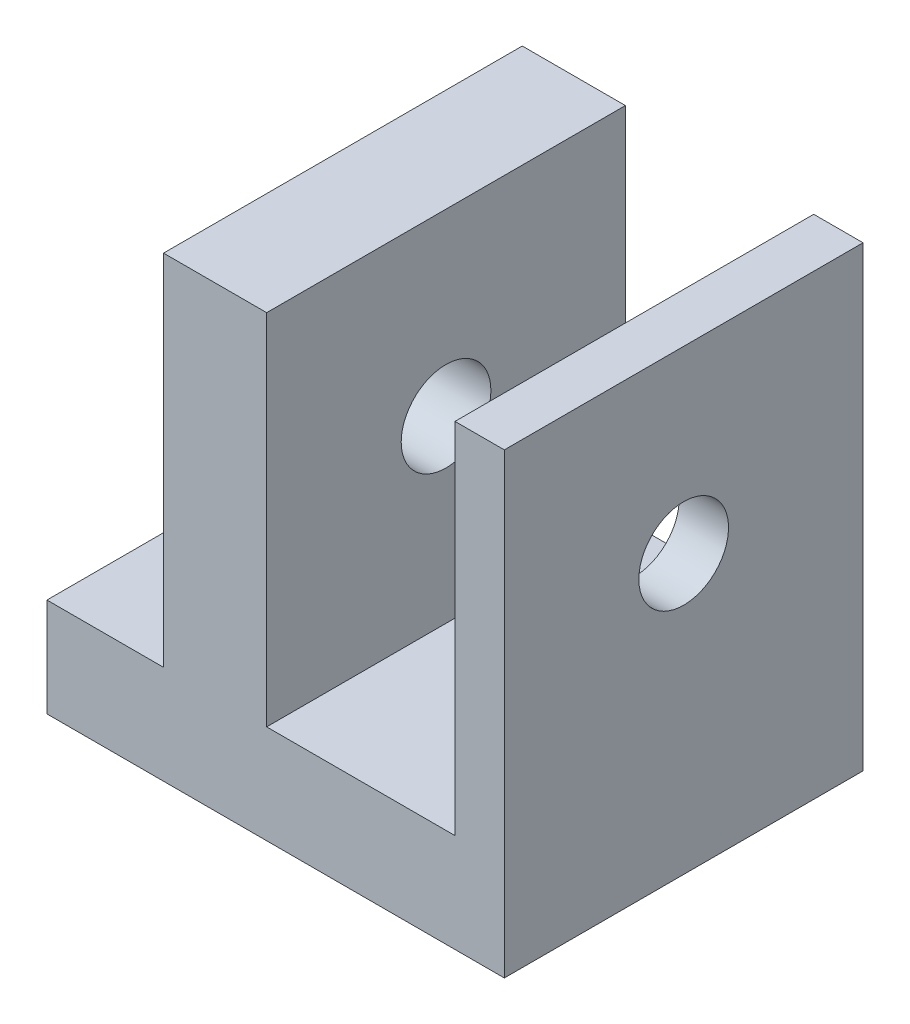
from build123d import *

# Parameters (mm, degrees)
BODY_START           = -10
BODY_DEPTH           = 20
M3_CLEARANCE_HOLE1_D = 3.4
CUT_EXTRUDE1_REACH   = 34.389
SKETCH4_R            = 2.5


# Read off the part's stored shape, not the designer's step: Body
with BuildPart() as part:
    # Body outline → Body (new body)
    with BuildSketch(Plane.XY.offset(BODY_START)):
        Polygon((10, 24.25), (10, 4.25), (-0.5, 4.25), (-0.5, 24.25), (-6.25, 24.25), (-6.25, 4.25), (-12.75, 4.25), (-12.75, -1.25), (12.75, -1.25), (12.75, 24.25), align=None)
    extrude(amount=BODY_DEPTH)

    # M3 Clearance Hole1 (through all)
    with Locations(Plane(origin=(0, -1.25, 0), x_dir=(-1, 0, 0), z_dir=(0, -1, 0))):
        with Locations((9.5, -3), (9.5, 3)):
            Hole(M3_CLEARANCE_HOLE1_D / 2)

    # Cut-Extrude1: up to this face of the body (flat: up to its plane)
    cut_extrude1_end = Plane(part.part.faces().sort_by_distance((12.75, 11.5, 0))[0])
    # Sketch4 → Cut-Extrude1 (cut, up to the picked face)
    with BuildSketch(Plane.ZY.offset(6.25), mode=Mode.PRIVATE) as cut_extrude1_sk1:
        with Locations((0, 14.25)):
            Circle(SKETCH4_R)
    cut_extrude1_tool1 = split(extrude(cut_extrude1_sk1.sketch, amount=-CUT_EXTRUDE1_REACH, mode=Mode.PRIVATE), bisect_by=cut_extrude1_end, keep=Keep.BOTH, mode=Mode.PRIVATE)
    add(cut_extrude1_tool1.solids().sort_by(Axis((-6.25, 14.25, 0), (1, 0, 0)))[0], mode=Mode.SUBTRACT)


solid = part.part
